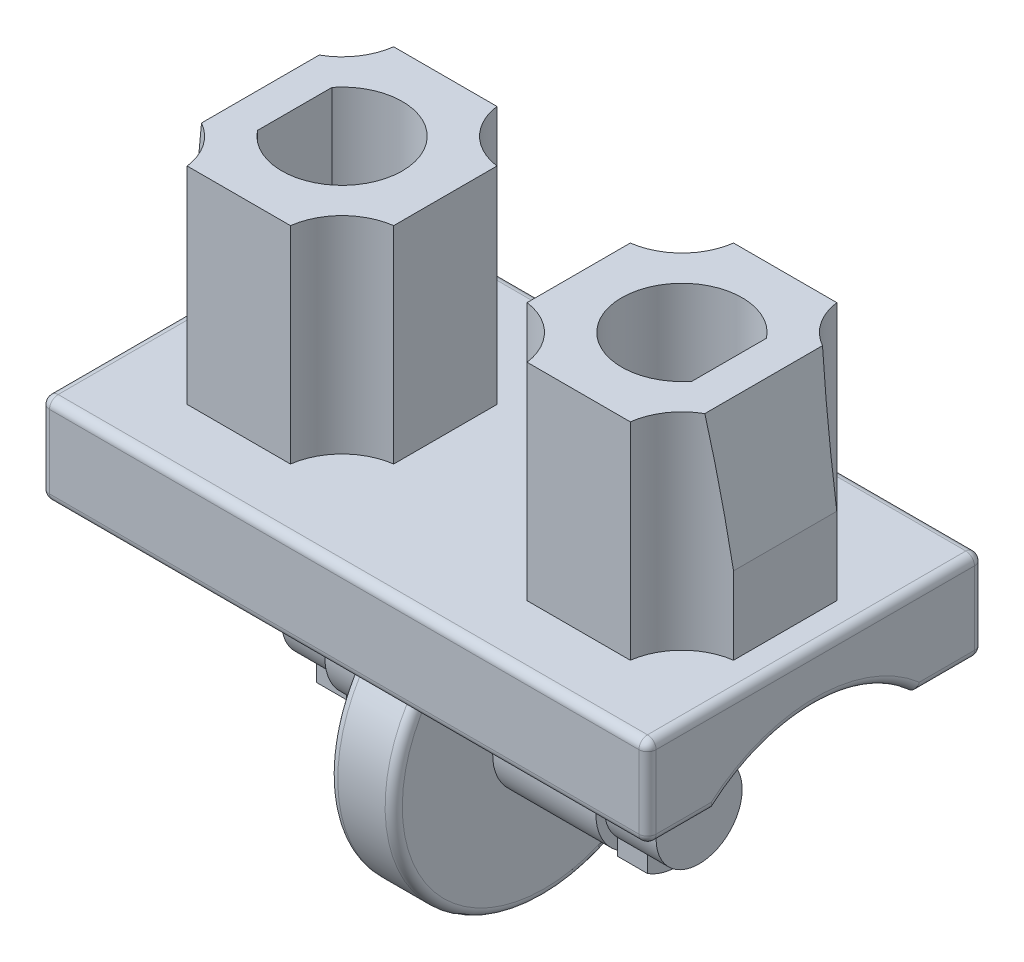
from build123d import *

# Parameters (mm, degrees)
BOSS_EXTRUDE1_DEPTH = 7.05
SKETCH1_5_R         = 3.5
BOSS_EXTRUDE2_DEPTH = 0.75
SKETCH2_R           = 1.2
BOSS_EXTRUDE3_DEPTH = 2.4
SKETCH3_R           = 1
BOSS_EXTRUDE4_DEPTH = 1.2
CUT_EXTRUDE1_START  = -1.2
CUT_EXTRUDE1_DEPTH  = 1.2
BOSS_EXTRUDE5_DEPTH = 0.7
BOSS_EXTRUDE6_DEPTH = 4.8
CUT_EXTRUDE2_DEPTH  = 4.8
CUT_EXTRUDE3_DEPTH  = 13.515290648
FILLET1_R           = 0.2


with BuildPart() as part:
    # Sketch1 → Boss-Extrude1 (new body)
    with BuildSketch(Plane(origin=(0, 0, 0), x_dir=(0, 0, -1), z_dir=(1, 0, 0))):
        with BuildLine():
            ThreePointArc((-2.343074903, -2.1), (0, -1.2), (2.343074903, -2.1))
            Line((2.343074903, -2.1), (3.9, -2.1))
            Line((3.9, -2.1), (3.9, 0))
            Line((3.9, 0), (-3.9, 0))
            Line((-3.9, 0), (-3.9, -2.1))
            Line((-3.9, -2.1), (-2.343074903, -2.1))
        make_face()
    extrude(amount=BOSS_EXTRUDE1_DEPTH)

    # Sketch1<5> → Boss-Extrude2 (add)
    with BuildSketch(Plane(origin=(0, 0, 0), x_dir=(0, 0, -1), z_dir=(1, 0, 0))):
        with Locations((0, -4.7)):
            Circle(SKETCH1_5_R)
    extrude(amount=BOSS_EXTRUDE2_DEPTH)

    # Sketch2 → Boss-Extrude3 (add)
    with BuildSketch(Plane(origin=(0.75, 0, 0), x_dir=(0, 0, -1), z_dir=(1, 0, 0))):
        with Locations((0, -4.7)):
            Circle(SKETCH2_R)
    extrude(amount=BOSS_EXTRUDE3_DEPTH)

    # Sketch3 → Boss-Extrude4 (add)
    with BuildSketch(Plane(origin=(3.15, 0, 0), x_dir=(0, 0, -1), z_dir=(1, 0, 0))):
        with Locations((0, -4.7)):
            Circle(SKETCH3_R)
    extrude(amount=BOSS_EXTRUDE4_DEPTH)

    # Sketch4 → Cut-Extrude1 (cut)
    with BuildSketch(Plane(origin=(4.35, 0, 0), x_dir=(0, 0, -1), z_dir=(1, 0, 0)).offset(CUT_EXTRUDE1_START)):
        with BuildLine():
            Line((-0.661437828, -3.95), (0.661437828, -3.95))
            ThreePointArc((0.661437828, -3.95), (0, -3.7), (-0.661437828, -3.95))
        make_face()
    extrude(amount=CUT_EXTRUDE1_DEPTH, mode=Mode.SUBTRACT)

    # Sketch5 → Boss-Extrude5 (add)
    with BuildSketch(Plane(origin=(3.15, 0, 0), x_dir=(0, 0, -1), z_dir=(1, 0, 0))):
        with BuildLine():
            Line((-0.7, -5.414142843), (-0.7, -5.794142843))
            ThreePointArc((-0.7, -5.794142843), (0, -5.99890283), (0.7, -5.794142843))
            Line((0.7, -5.794142843), (0.7, -5.414142843))
            ThreePointArc((0.7, -5.414142843), (0, -5.7), (-0.7, -5.414142843))
        make_face()
    extrude(amount=BOSS_EXTRUDE5_DEPTH)

    # Sketch6 → Boss-Extrude6 (add)
    with BuildSketch(Plane(origin=(0, 0, 0), x_dir=(1, 0, 0), z_dir=(0, 1, 0))):
        with BuildLine():
            ThreePointArc((1.55, -1.2), (2.352548706, -1.597451294), (2.75, -2.4))
            Line((2.75, -2.4), (5.15, -2.4))
            ThreePointArc((5.15, -2.4), (5.547451294, -1.597451294), (6.35, -1.2))
            Line((6.35, -1.2), (6.35, 1.2))
            ThreePointArc((6.35, 1.2), (5.547451294, 1.597451294), (5.15, 2.4))
            Line((5.15, 2.4), (2.75, 2.4))
            ThreePointArc((2.75, 2.4), (2.352548706, 1.597451294), (1.55, 1.2))
            Line((1.55, 1.2), (1.55, -1.2))
        make_face()
    extrude(amount=BOSS_EXTRUDE6_DEPTH)

    # Sketch7 → Cut-Extrude2 (cut)
    with BuildSketch(Plane(origin=(0, 4.8, 0), x_dir=(1, 0, 0), z_dir=(0, 1, 0))):
        with BuildLine():
            Line((5.05, 0.866025404), (5.05, -0.866025404))
            ThreePointArc((5.05, -0.866025404), (2.55, 0), (5.05, 0.866025404))
        make_face()
    extrude(amount=-CUT_EXTRUDE2_DEPTH, mode=Mode.SUBTRACT)

    # Sketch8 → Cut-Extrude3 (cut, through all)
    with BuildSketch(Plane.XY.offset(2.4)):
        Polygon((5.85, 4.8), (6.35, 4.8), (6.35, 1.8), align=None)
    extrude(amount=-CUT_EXTRUDE3_DEPTH, mode=Mode.SUBTRACT)

    # Fillet1
    # the kernel refuses this fillet: 0.2 mm, written as the material it takes off along each edge
    with BuildSketch(Plane(origin=(6.85, -1.9, 3.7), x_dir=(1, 0, 0), z_dir=(0, 0, 1))) as fillet1_piece_1_section:
        Polygon((0, 0), (FILLET1_R * 1.02, 0), (FILLET1_R * 1.02, -FILLET1_R * 1.02), (0, -FILLET1_R * 1.02), align=None)
    fillet1_piece_1 = extrude(amount=FILLET1_R * 1.02, mode=Mode.PRIVATE)
    fillet1_piece_1 = fillet1_piece_1 - Plane(origin=(6.85, -1.9, 3.7), x_dir=(-0.7071067811865475, 0.7071067811865475, 0), z_dir=(0, 0, 1)) * Sphere(FILLET1_R, mode=Mode.PRIVATE)
    add(fillet1_piece_1, mode=Mode.SUBTRACT)
    with BuildSketch(Plane(origin=(6.85, -0.2, 3.7), x_dir=(0, 0, 1), z_dir=(0, 1, 0))) as fillet1_piece_2_section:
        Polygon((0, 0), (FILLET1_R * 1.02, 0), (FILLET1_R * 1.02, FILLET1_R * 1.02), (0, FILLET1_R * 1.02), align=None)
    fillet1_piece_2 = extrude(amount=FILLET1_R * 1.02, mode=Mode.PRIVATE)
    fillet1_piece_2 = fillet1_piece_2 - Plane(origin=(6.85, -0.2, 3.7), x_dir=(-0.7071067811865475, 0, -0.7071067811865475), z_dir=(0, 1, 0)) * Sphere(FILLET1_R, mode=Mode.PRIVATE)
    add(fillet1_piece_2, mode=Mode.SUBTRACT)
    with BuildSketch(Plane(origin=(6.85, -0.2, -3.7), x_dir=(1, 0, 0), z_dir=(0, 1, 0))) as fillet1_piece_3_section:
        Polygon((0, 0), (FILLET1_R * 1.02, 0), (FILLET1_R * 1.02, FILLET1_R * 1.02), (0, FILLET1_R * 1.02), align=None)
    fillet1_piece_3 = extrude(amount=FILLET1_R * 1.02, mode=Mode.PRIVATE)
    fillet1_piece_3 = fillet1_piece_3 - Plane(origin=(6.85, -0.2, -3.7), x_dir=(-0.7071067811865475, 0, 0.7071067811865475), z_dir=(0, 1, 0)) * Sphere(FILLET1_R, mode=Mode.PRIVATE)
    add(fillet1_piece_3, mode=Mode.SUBTRACT)
    with BuildSketch(Plane(origin=(6.85, -1.9, -3.7), x_dir=(1, 0, 0), z_dir=(0, -1, 0))) as fillet1_piece_4_section:
        Polygon((0, 0), (FILLET1_R * 1.02, 0), (FILLET1_R * 1.02, -FILLET1_R * 1.02), (0, -FILLET1_R * 1.02), align=None)
    fillet1_piece_4 = extrude(amount=FILLET1_R * 1.02, mode=Mode.PRIVATE)
    fillet1_piece_4 = fillet1_piece_4 - Plane(origin=(6.85, -1.9, -3.7), x_dir=(-0.7071067811865475, 0, 0.7071067811865475), z_dir=(0, -1, 0)) * Sphere(FILLET1_R, mode=Mode.PRIVATE)
    add(fillet1_piece_4, mode=Mode.SUBTRACT)
    with BuildSketch(Plane(origin=(-0.5, -2.1, 3.9), x_dir=(0, 0, -1), z_dir=(1, 0, 0))) as fillet1_piece_5:
        with BuildLine():
            CenterArc((FILLET1_R, FILLET1_R), FILLET1_R, 180, 90)
            Line((0, FILLET1_R), (0, 0))
            Line((0, 0), (FILLET1_R, 0))
        make_face()
    extrude(amount=7.35, mode=Mode.SUBTRACT)
    with BuildSketch(Plane(origin=(-0.5, 0, 3.9), x_dir=(0, 0, -1), z_dir=(1, 0, 0)), Plane(origin=(-0.5, 0, -3.9), x_dir=(0, -1, 0), z_dir=(1, 0, 0)), Plane(origin=(-0.5, -2.1, -3.9), x_dir=(0, 0, 1), z_dir=(1, 0, 0))) as fillet1_piece_6:
        with BuildLine():
            CenterArc((FILLET1_R, -FILLET1_R), FILLET1_R, 90, 90)
            Line((0, -FILLET1_R), (0, 0))
            Line((0, 0), (FILLET1_R, 0))
        make_face()
    extrude(amount=7.35, mode=Mode.SUBTRACT)
    with BuildSketch(Plane(origin=(7.05, -1.9, -3.9), x_dir=(0, 0, 1), z_dir=(0, 1, 0)), Plane(origin=(7.05, -0.2, 3.9), x_dir=(0, 0, -1), z_dir=(0, -1, 0))) as fillet1_piece_7:
        with BuildLine():
            CenterArc((FILLET1_R, -FILLET1_R), FILLET1_R, 90, 90)
            Line((0, -FILLET1_R), (0, 0))
            Line((0, 0), (FILLET1_R, 0))
        make_face()
    extrude(amount=1.7, mode=Mode.SUBTRACT)
    with BuildSketch(Plane(origin=(7.05, 0, -3.7), x_dir=(0, -1, 0), z_dir=(0, 0, 1))) as fillet1_piece_8:
        with BuildLine():
            CenterArc((FILLET1_R, -FILLET1_R), FILLET1_R, 90, 90)
            Line((0, -FILLET1_R), (0, 0))
            Line((0, 0), (FILLET1_R, 0))
        make_face()
    extrude(amount=7.4, mode=Mode.SUBTRACT)
    with BuildSketch(Plane(origin=(0.75, -4.7, 0), x_dir=(0, 0.8309016210227964, 0.5564193528101707), z_dir=(0, 0.5564193528101707, -0.8309016210227964))) as fillet1_piece_9_section:
        with BuildLine():
            CenterArc((3.5 - FILLET1_R, -FILLET1_R), FILLET1_R, 0, 90)
            Line((3.5, -FILLET1_R), (3.5, 0))
            Line((3.5, 0), (3.5 - FILLET1_R, 0))
        make_face()
    fillet1_piece_9 = revolve(axis=Axis((0.75, -4.7, 0), (1, 0, 0)), revolution_arc=292.382935953, mode=Mode.PRIVATE)
    fillet1_piece_9 = split(fillet1_piece_9, bisect_by=Plane(origin=(0.695125207, -2.1, 0), z_dir=(0, -1, 0)), keep=Keep.TOP, mode=Mode.PRIVATE)
    add(fillet1_piece_9, mode=Mode.SUBTRACT)
    with BuildSketch(Plane(origin=(7.05, -2.1, 3.7), x_dir=(0, 1, 0), z_dir=(0, 0, -1))) as fillet1_piece_10:
        with BuildLine():
            CenterArc((FILLET1_R, -FILLET1_R), FILLET1_R, 90, 90)
            Line((0, -FILLET1_R), (0, 0))
            Line((0, 0), (FILLET1_R, 0))
        make_face()
    extrude(amount=1.856925097, mode=Mode.SUBTRACT)
    with BuildSketch(Plane(origin=(7.05, -4.7, 0), x_dir=(0, 0.6399406433840084, 0.7684243443210669), z_dir=(0, -0.7684243443210669, 0.6399406433840084))) as fillet1_piece_11:
        with BuildLine():
            CenterArc((3.5 + FILLET1_R, FILLET1_R), FILLET1_R, 180, 90)
            Line((3.5 + FILLET1_R, 0), (3.5, 0))
            Line((3.5, 0), (3.5, FILLET1_R))
        make_face()
    revolve(axis=Axis((7.05, -4.7, 0), (-1, 0, 0)), revolution_arc=100.425212863, mode=Mode.SUBTRACT)
    with BuildSketch(Plane(origin=(7.05, -2.1, -1.843074903), x_dir=(-1, 0, 0), z_dir=(0, 0, -1))) as fillet1_piece_12:
        with BuildLine():
            CenterArc((FILLET1_R, FILLET1_R), FILLET1_R, 180, 90)
            Line((0, FILLET1_R), (0, 0))
            Line((0, 0), (FILLET1_R, 0))
        make_face()
    extrude(amount=1.856925097, mode=Mode.SUBTRACT)

    # Mirror1: part across plane


with BuildPart() as part_1:
    add(part.part)
    add(part.part.mirror(Plane(origin=(0, 0, 0), x_dir=(0, 0, 1), z_dir=(1, 0, 0))))


solid = part_1.part
